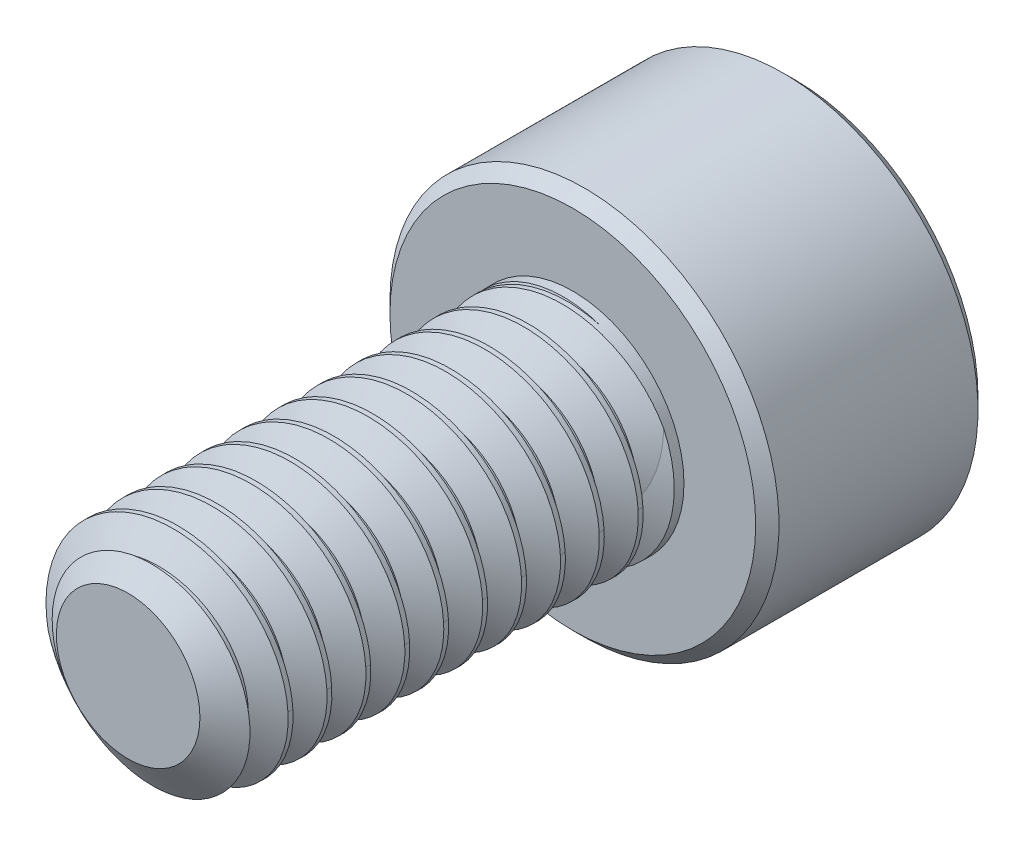
from build123d import *

# Parameters (mm, degrees)
SKETCH1_R          = 2
EXTRUDE1_DEPTH     = 8
CUT_SWEEP1_PITCH   = 0.7
SKETCH6_R          = 3.5
EXTRUDE2_DEPTH     = 4
CUT_EXTRUDE1_DEPTH = 2.25
CHAMFER1_SIZE      = 0.21


with BuildPart() as part:
    # Sketch1 → Extrude1 (new body)
    with BuildSketch(Plane.XY):
        Circle(SKETCH1_R)
    extrude(amount=-EXTRUDE1_DEPTH)

    # Cut-Sweep1: the profile of Sketch3 profile screwed along a right-hand helix of 12.428571 turns, 6 arcs to a turn; built about Z, then put on its axis
    cut_sweep1_z = Axis((0, 0, 0), (0, 0, 1))
    cut_sweep1_corners = [(2.0003, 0, -0.612673205), (1.545336663, 0, -0.35), (1.545336663, 0, -0.2625), (2.0003, 0, 0.000173205)]
    with BuildLine(mode=Mode.PRIVATE) as cut_sweep1_profile:
        Line(cut_sweep1_corners[0], cut_sweep1_corners[1])
        Line(cut_sweep1_corners[1], cut_sweep1_corners[2])
        Line(cut_sweep1_corners[2], cut_sweep1_corners[3])
        Line(cut_sweep1_corners[3], cut_sweep1_corners[0])
    cut_sweep1_cap = Face(cut_sweep1_profile.wire())
    cut_sweep1_turn_angles = [0, 30, 60, 90, 120, 150, 180, 210, 240, 270, 300, 330, 360]
    cut_sweep1_turn_weights = [1, 0.8660254037844387, 1, 0.8660254037844387, 1, 0.8660254037844387, 1, 0.8660254037844387, 1, 0.8660254037844387, 1, 0.8660254037844387, 1]
    cut_sweep1_turn_rails = [Edge.make_bspline([Vector(p[0], p[1], 0).rotate(cut_sweep1_z, cut_sweep1_turn_angles[k]) / cut_sweep1_turn_weights[k] + Vector(0, 0, p[2] + CUT_SWEEP1_PITCH * cut_sweep1_turn_angles[k] / 360) for k in range(13)], [0, 0, 0, 1, 1, 2, 2, 3, 3, 4, 4, 5, 5, 6, 6, 6], 2, cut_sweep1_turn_weights) for p in cut_sweep1_corners]
    cut_sweep1_turn_sides = [Face.make_surface_from_curves(cut_sweep1_turn_rails[p[0]], cut_sweep1_turn_rails[p[1]]) for p in [(0, 1), (1, 2), (2, 3), (3, 0)]]
    cut_sweep1_last_angles = [4320, 4350, 4380, 4410, 4440, 4457.142857143, 4474.285714286]
    cut_sweep1_last_weights = [1, 0.8660254037844387, 1, 0.8660254037844387, 1, 0.9555728057861561, 1]
    cut_sweep1_last_rails = [Edge.make_bspline([Vector(p[0], p[1], 0).rotate(cut_sweep1_z, cut_sweep1_last_angles[k]) / cut_sweep1_last_weights[k] + Vector(0, 0, p[2] + CUT_SWEEP1_PITCH * cut_sweep1_last_angles[k] / 360) for k in range(7)], [0, 0, 0, 1, 1, 2, 2, 3, 3, 3], 2, cut_sweep1_last_weights) for p in cut_sweep1_corners]
    cut_sweep1_last_sides = [Face.make_surface_from_curves(cut_sweep1_last_rails[p[0]], cut_sweep1_last_rails[p[1]]) for p in [(0, 1), (1, 2), (2, 3), (3, 0)]]
    cut_sweep1 = Plane(origin=(0, 0, 0), x_dir=(0, 1, 0), z_dir=(0, 0, -1)) * Solid(Shell([*[p.moved(Location((0, 0, CUT_SWEEP1_PITCH * i))) for i in range(12) for p in cut_sweep1_turn_sides], *cut_sweep1_last_sides, cut_sweep1_cap, cut_sweep1_cap.rotate(cut_sweep1_z, 4474.285714286).moved(Location((0, 0, CUT_SWEEP1_PITCH * 4474.285714286 / 360)))]))
    add(cut_sweep1, mode=Mode.SUBTRACT)

    # Sketch4 → Cut-Revolve1 (revolve, cut)
    with BuildSketch(Plane(origin=(0, 0, 0), x_dir=(0, 0, -1), z_dir=(1, 0, 0)), mode=Mode.PRIVATE) as cut_revolve1_sk:
        Polygon((0.496211411, 2), (0, 1.291336663), (0, 2), align=None)
    revolve(cut_revolve1_sk.sketch.rotate(Axis((0, 0, 0), (0, 0, -1)), 271.401126896), axis=Axis((0, 0, 0), (0, 0, -1)), mode=Mode.SUBTRACT)

    # Sketch6 → Extrude2 (add)
    with BuildSketch(Plane(origin=(0, 0, -8), x_dir=(-1, 0, 0), z_dir=(0, 0, -1))):
        Circle(SKETCH6_R)
    extrude(amount=EXTRUDE2_DEPTH)

    # Sketch7 → Cut-Extrude1 (cut)
    with BuildSketch(Plane(origin=(0, 0, -12), x_dir=(-1, 0, 0), z_dir=(0, 0, -1))):
        Polygon((0, 1.732050808), (-1.5, 0.866025404), (-1.5, -0.866025404), (0, -1.732050808), (1.5, -0.866025404), (1.5, 0.866025404), align=None)
    extrude(amount=-CUT_EXTRUDE1_DEPTH, mode=Mode.SUBTRACT)

    # Cut-Extrude2 cone 1 section (through the dimple's axis) → Cut-Extrude2 (revolve, cut)
    with BuildSketch(Plane(origin=(0, 0, -12), x_dir=(0, 1, 0), z_dir=(1, 0, 0))):
        Polygon((0, 0), (1.732050808, 0), (0, 1.732050808), align=None)
    revolve(axis=Axis((0, 0, -12), (0, 0, 1)), mode=Mode.SUBTRACT)

    # Chamfer1
    chamfer1_edges = [part.edges().sort_by_distance(p)[0] for p in [
        (3.5, 0, -8),
        (3.5, 0, -12),
    ]]
    chamfer(chamfer1_edges, length=CHAMFER1_SIZE)

    # Sketch10 → Revolve1 (revolve)
    with BuildSketch(Plane(origin=(0, 0, 0), x_dir=(0, 0, -1), z_dir=(1, 0, 0)), mode=Mode.PRIVATE) as revolve1_sk:
        Polygon((8, 2), (8, 0), (6.996572875, 0), (7.825, 2), align=None)
    revolve(revolve1_sk.sketch.rotate(Axis((0, 0, -8), (0, 0, 1)), 270), axis=Axis((0, 0, -8), (0, 0, 1)))


solid = part.part
